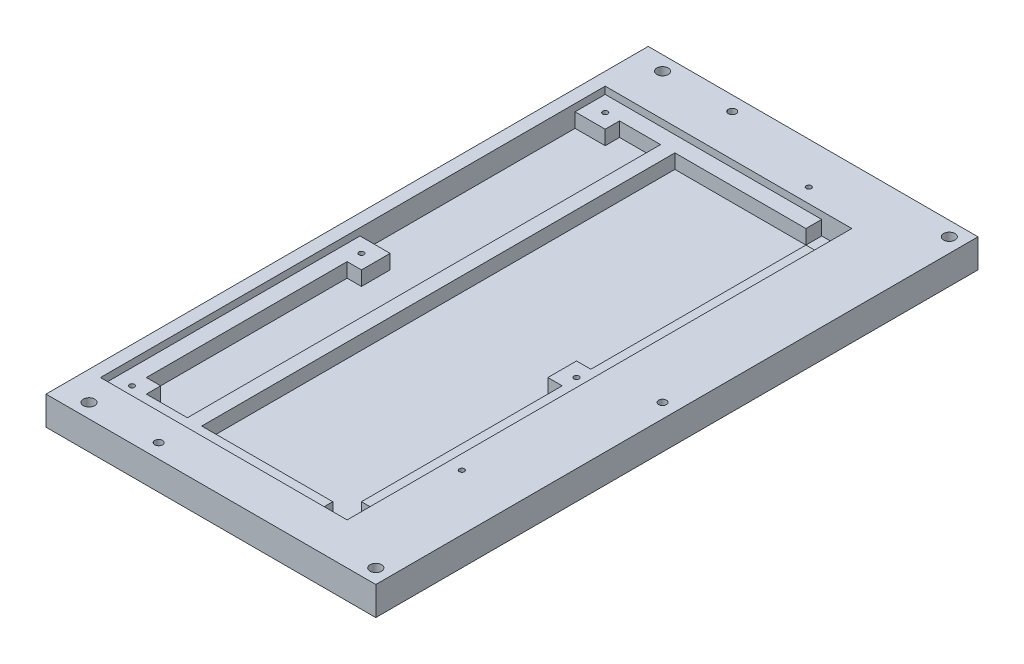
from build123d import *

# Parameters (mm, degrees)
SKETCH1_W                  = 146.05
SKETCH1_H                  = 266.7
BOSS_EXTRUDE1_DEPTH        = 12.7
SKETCH2_W                  = 109.22
SKETCH2_H                  = 223.52
CUT_EXTRUDE1_DEPTH         = 3.175
CUT_EXTRUDE2_DEPTH         = 6.35
F_4_40_TAPPED_HOLE1_D      = 2.2606
F_4_40_TAPPED_HOLE1_DEPTH  = 6.35
F_4_40_TAPPED_HOLE1_TIP    = 0.679152758
F_8_0_199_DIAMETER_HOLE2_D = 5.0546
F_8_32_TAPPED_HOLE1_D      = 3.4544
F_8_32_TAPPED_HOLE1_DEPTH  = 9.525
F_8_32_TAPPED_HOLE1_TIP    = 1.037806461
F_4_40_TAPPED_HOLE2_D      = 2.2606
F_4_40_TAPPED_HOLE2_DEPTH  = 9.652
F_4_40_TAPPED_HOLE2_TIP    = 0.679152758


with BuildPart() as part:
    # Sketch1 → Boss-Extrude1 (new body)
    with BuildSketch(Plane(origin=(0, 0, 0), x_dir=(1, 0, 0), z_dir=(0, 1, 0))):
        with Locations((73.025, 133.35)):
            Rectangle(SKETCH1_W, SKETCH1_H)
    extrude(amount=BOSS_EXTRUDE1_DEPTH)

    # Sketch2 → Cut-Extrude1 (cut)
    with BuildSketch(Plane(origin=(0, 12.7, 0), x_dir=(1, 0, 0), z_dir=(0, 1, 0))):
        with Locations((60.325, 130.175)):
            Rectangle(SKETCH2_W, SKETCH2_H)
    extrude(amount=-CUT_EXTRUDE1_DEPTH, mode=Mode.SUBTRACT)

    # Sketch3 → Cut-Extrude2 (cut)
    with BuildSketch(Plane(origin=(0, 9.525, 0), x_dir=(1, 0, 0), z_dir=(0, 1, 0))):
        Polygon((19.05, 31.75), (19.05, 25.4), (37.211, 25.4), (37.211, 234.95), (19.05, 234.95), (19.05, 228.6), (5.715, 228.6), (5.715, 133.35), (19.05, 133.35), (19.05, 120.65), (12.7, 120.65), (12.7, 31.75), align=None)
        Polygon((43.561, 25.4), (101.6, 25.4), (101.6, 18.415), (114.935, 18.415), (114.935, 31.75), (107.95, 31.75), (107.95, 120.65), (101.6, 120.65), (101.6, 133.35), (107.95, 133.35), (107.95, 228.6), (114.935, 228.6), (114.935, 241.935), (101.6, 241.935), (101.6, 234.95), (43.561, 234.95), align=None)
    extrude(amount=-CUT_EXTRUDE2_DEPTH, mode=Mode.SUBTRACT)

    # #4-40 Tapped Hole1
    with Locations(Plane(origin=(0, 9.525, 0), x_dir=(1, 0, 0), z_dir=(0, 1, 0))):
        with Locations((12.7, 127), (107.95, 127), (12.7, 234.95), (12.7, 25.4)):
            Hole(F_4_40_TAPPED_HOLE1_D / 2, depth=F_4_40_TAPPED_HOLE1_DEPTH)
            with Locations((0, 0, -(F_4_40_TAPPED_HOLE1_DEPTH + F_4_40_TAPPED_HOLE1_TIP / 2))):  # 118° drill point
                Cone(0, F_4_40_TAPPED_HOLE1_D / 2, F_4_40_TAPPED_HOLE1_TIP, mode=Mode.SUBTRACT)

    # #8 (0.199) Diameter Hole2 (through all)
    with Locations(Plane(origin=(0, 12.7, 0), x_dir=(1, 0, 0), z_dir=(0, 1, 0))):
        with Locations((12.7, 6.35), (139.7, 6.35), (139.7, 260.35), (12.7, 260.35)):
            Hole(F_8_0_199_DIAMETER_HOLE2_D / 2)

    # #8-32 Tapped Hole1
    with Locations(Plane(origin=(0, 12.7, 0), x_dir=(1, 0, 0), z_dir=(0, 1, 0))):
        with Locations((43.561, 6.35), (43.561, 260.35), (139.7, 133.35)):
            Hole(F_8_32_TAPPED_HOLE1_D / 2, depth=F_8_32_TAPPED_HOLE1_DEPTH)
            with Locations((0, 0, -(F_8_32_TAPPED_HOLE1_DEPTH + F_8_32_TAPPED_HOLE1_TIP / 2))):  # 118° drill point
                Cone(0, F_8_32_TAPPED_HOLE1_D / 2, F_8_32_TAPPED_HOLE1_TIP, mode=Mode.SUBTRACT)

    # #4-40 Tapped Hole2
    with Locations(Plane(origin=(0, 12.7, 0), x_dir=(1, 0, 0), z_dir=(0, 1, 0))):
        with Locations((89.535, 248.285), (121.285, 62.865)):
            Hole(F_4_40_TAPPED_HOLE2_D / 2, depth=F_4_40_TAPPED_HOLE2_DEPTH)
            with Locations((0, 0, -(F_4_40_TAPPED_HOLE2_DEPTH + F_4_40_TAPPED_HOLE2_TIP / 2))):  # 118° drill point
                Cone(0, F_4_40_TAPPED_HOLE2_D / 2, F_4_40_TAPPED_HOLE2_TIP, mode=Mode.SUBTRACT)


solid = part.part
